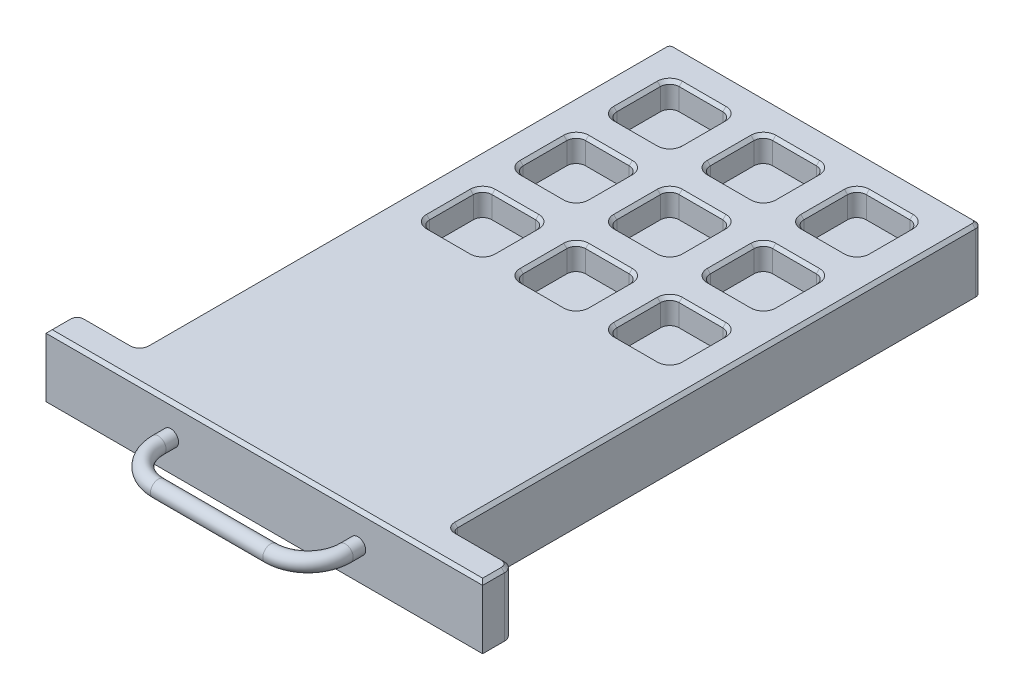
from build123d import *

# Parameters (mm, degrees)
EXTRUDE_1_DEPTH             = 20
CUT_EXTRUDE_3_DEPTH         = 8
PATTERN_LINEAR_3_COUNT      = 3
PATTERN_LINEAR_3_PITCH      = 30
PATTERN_LINEAR_3_COUNT_DIR2 = 3
PATTERN_LINEAR_3_PITCH_DIR2 = 30
CHAMFER_3_SIZE              = 1
SKETCH_5_R                  = 2.5


with BuildPart() as part:
    # 草图1 → 凸台-拉伸1 (new body)
    with BuildSketch(Plane(origin=(0, 0, 0), x_dir=(1, 0, 0), z_dir=(0, 1, 0))):
        with BuildLine():
            Line((-48, 180), (48, 180))
            ThreePointArc((48, 180), (49.414213562, 179.414213562), (50, 178))
            Line((50, 178), (50, 12))
            ThreePointArc((50, 12), (50.585786438, 10.585786438), (52, 10))
            Line((52, 10), (67, 10))
            ThreePointArc((67, 10), (69.121320344, 9.121320344), (70, 7))
            Line((70, 7), (70, 0))
            Line((70, 0), (-70, 0))
            Line((-70, 0), (-70, 7))
            ThreePointArc((-70, 7), (-69.121320344, 9.121320344), (-67, 10))
            Line((-67, 10), (-52, 10))
            ThreePointArc((-52, 10), (-50.585786438, 10.585786438), (-50, 12))
            Line((-50, 12), (-50, 178))
            ThreePointArc((-50, 178), (-49.414213562, 179.414213562), (-48, 180))
        make_face()
    extrude(amount=EXTRUDE_1_DEPTH)

    # 草图3 → 切除-拉伸3 (cut)
    with BuildSketch(Plane(origin=(0, 20, 0), x_dir=(1, 0, 0), z_dir=(0, 1, 0))):
        with BuildLine():
            Line((-37, 170), (-23, 170))
            ThreePointArc((-23, 170), (-20.878679656, 169.121320344), (-20, 167))
            Line((-20, 167), (-20, 153))
            ThreePointArc((-20, 153), (-20.878679656, 150.878679656), (-23, 150))
            Line((-23, 150), (-37, 150))
            ThreePointArc((-37, 150), (-39.121320344, 150.878679656), (-40, 153))
            Line((-40, 153), (-40, 167))
            ThreePointArc((-40, 167), (-39.121320344, 169.121320344), (-37, 170))
        make_face()
    cut_extrude_3 = extrude(amount=-CUT_EXTRUDE_3_DEPTH, mode=Mode.SUBTRACT)

    # 阵列(线性)3: Cut-Extrude 3 3 × 3
    with Locations(*[(i * PATTERN_LINEAR_3_PITCH, 0, j * PATTERN_LINEAR_3_PITCH_DIR2) for i in range(PATTERN_LINEAR_3_COUNT) for j in range(PATTERN_LINEAR_3_COUNT_DIR2) if (i, j) != (0, 0)]):
        add(cut_extrude_3, mode=Mode.SUBTRACT)

    # 倒角3
    chamfer_3_edges = [part.edges().sort_by_distance(p)[0] for p in [
        (40, 20, -100),
        (39.121320344, 20, -109.121320344),
        (30, 20, -110),
        (20.878679656, 20, -109.121320344),
        (20, 20, -100),
        (20.878679656, 20, -90.878679656),
        (30, 20, -90),
        (39.121320344, 20, -90.878679656),
        (10, 20, -100),
        (9.121320344, 20, -109.121320344),
        (0, 20, -110),
        (-9.121320344, 20, -109.121320344),
        (-10, 20, -100),
        (-9.121320344, 20, -90.878679656),
        (0, 20, -90),
        (9.121320344, 20, -90.878679656),
        (-20, 20, -100),
        (-20.878679656, 20, -109.121320344),
        (-30, 20, -110),
        (-39.121320344, 20, -109.121320344),
        (-40, 20, -100),
        (-39.121320344, 20, -90.878679656),
        (-30, 20, -90),
        (-20.878679656, 20, -90.878679656),
        (40, 20, -130),
        (39.121320344, 20, -139.121320344),
        (30, 20, -140),
        (20.878679656, 20, -139.121320344),
        (20, 20, -130),
        (20.878679656, 20, -120.878679656),
        (30, 20, -120),
        (39.121320344, 20, -120.878679656),
        (10, 20, -130),
        (9.121320344, 20, -139.121320344),
        (0, 20, -140),
        (-9.121320344, 20, -139.121320344),
        (-10, 20, -130),
        (-9.121320344, 20, -120.878679656),
        (0, 20, -120),
        (9.121320344, 20, -120.878679656),
        (-20, 20, -130),
        (-20.878679656, 20, -139.121320344),
        (-30, 20, -140),
        (-39.121320344, 20, -139.121320344),
        (-40, 20, -130),
        (-39.121320344, 20, -120.878679656),
        (-30, 20, -120),
        (-20.878679656, 20, -120.878679656),
        (40, 20, -160),
        (39.121320344, 20, -169.121320344),
        (30, 20, -170),
        (20.878679656, 20, -169.121320344),
        (20, 20, -160),
        (20.878679656, 20, -150.878679656),
        (30, 20, -150),
        (39.121320344, 20, -150.878679656),
        (59.5, 20, -10),
        (69.121320344, 20, -9.121320344),
        (70, 20, -3.5),
        (0, 20, 0),
        (-70, 20, -3.5),
        (-69.121320344, 20, -9.121320344),
        (-59.5, 20, -10),
        (-50.585786438, 20, -10.585786438),
        (-50, 20, -95),
        (-49.414213562, 20, -179.414213562),
        (49.414213562, 20, -179.414213562),
        (50, 20, -95),
        (50.585786438, 20, -10.585786438),
        (-20.878679656, 20, -169.121320344),
        (-30, 20, -170),
        (-39.121320344, 20, -169.121320344),
        (-40, 20, -160),
        (-39.121320344, 20, -150.878679656),
        (-30, 20, -150),
        (-20.878679656, 20, -150.878679656),
        (-20, 20, -160),
        (9.121320344, 20, -169.121320344),
        (0, 20, -170),
        (-9.121320344, 20, -169.121320344),
        (-10, 20, -160),
        (-9.121320344, 20, -150.878679656),
        (0, 20, -150),
        (9.121320344, 20, -150.878679656),
        (10, 20, -160),
        (0, 20, -180),
    ]]
    chamfer(chamfer_3_edges, length=CHAMFER_3_SIZE)

    # 扫描1: sweep along a path in 草图4
    with BuildLine(Plane(origin=(0, 10, 0), x_dir=(-1, 0, 0), z_dir=(0, -1, 0))) as sweep_1_path:
        Line((-30, 0), (-30, -4))
        ThreePointArc((-30, -4), (-26.485281374, -12.485281374), (-18, -16))
        Line((-18, -16), (18, -16))
        ThreePointArc((18, -16), (26.485281374, -12.485281374), (30, -4))
        Line((30, -4), (30, 0))
    # 草图5 → 扫描1 (sweep)
    with BuildSketch(Plane.XY):
        with Locations((-30, 10)):
            Circle(SKETCH_5_R)
    sweep(path=sweep_1_path.line)


solid = part.part
